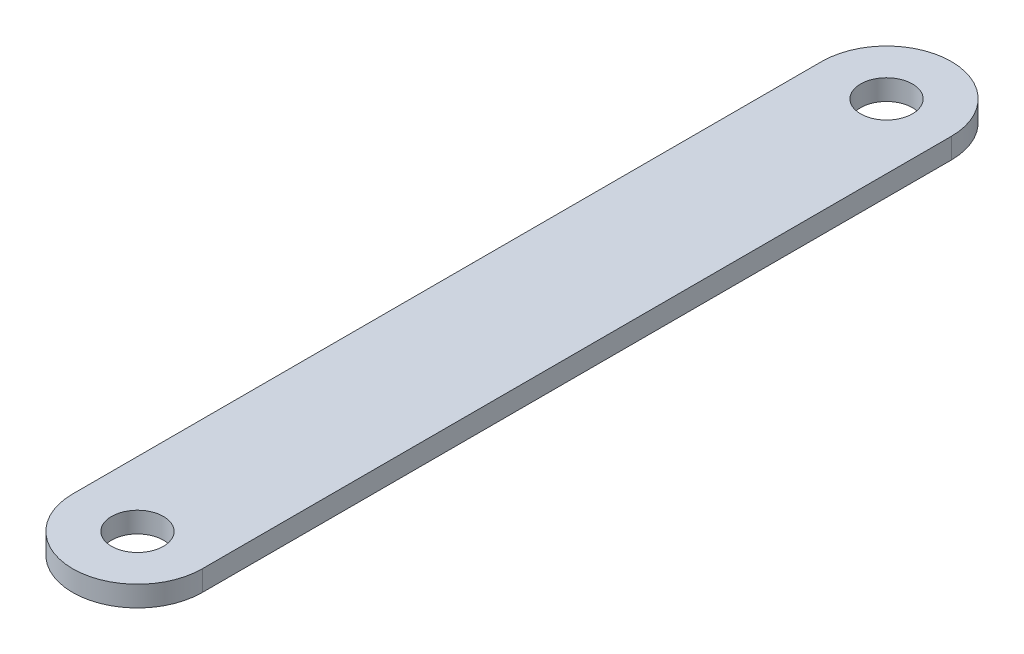
from build123d import *

# Parameters (mm, degrees)
SKETCH2_R           = 2
BOSS_EXTRUDE1_DEPTH = 1.5875


with BuildPart() as part:
    # Sketch2 → Boss-Extrude1 (new body)
    with BuildSketch(Plane(origin=(0, 0, 0), x_dir=(1, 0, 0), z_dir=(0, 1, 0))):
        with BuildLine():
            Line((-5, 57.8), (-5, 0))
            ThreePointArc((-5, 0), (0, -5), (5, 0))
            Line((5, 0), (5, 57.8))
            ThreePointArc((5, 57.8), (0, 62.8), (-5, 57.8))
        make_face()
        Circle(SKETCH2_R, mode=Mode.SUBTRACT)
        with Locations((0, 57.8)):
            Circle(SKETCH2_R, mode=Mode.SUBTRACT)
    extrude(amount=BOSS_EXTRUDE1_DEPTH)


solid = part.part
